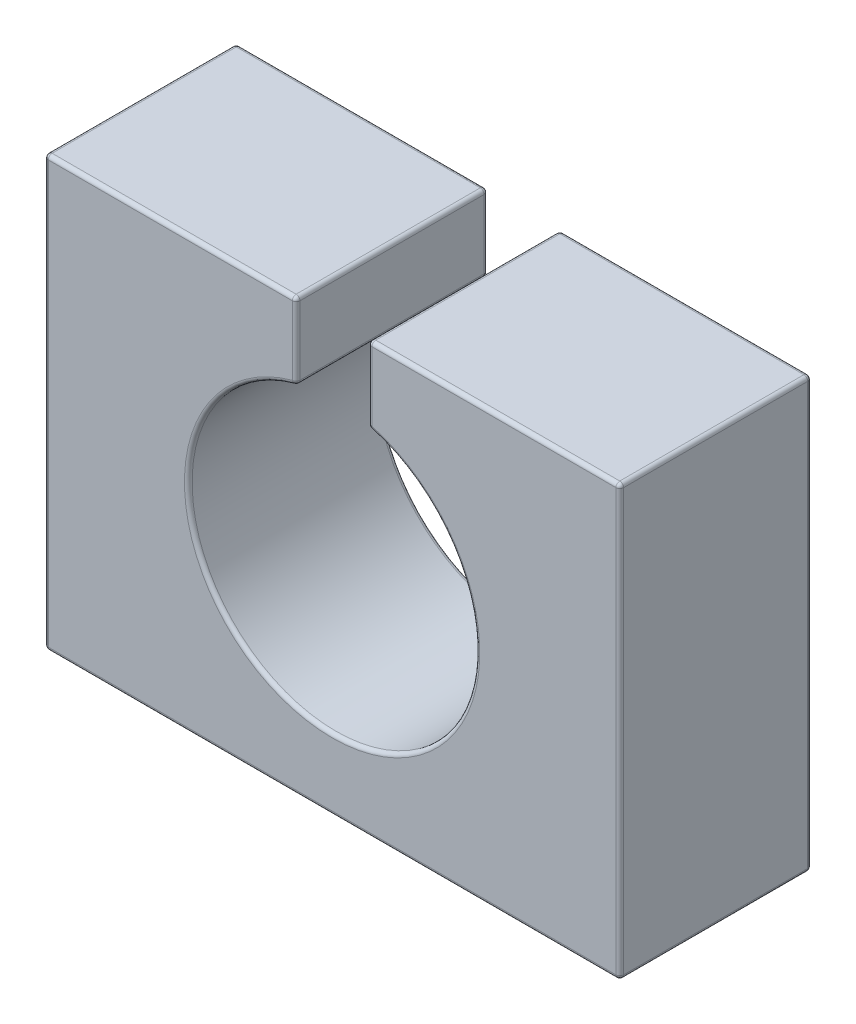
from build123d import *

# Parameters (mm, degrees)
SKETCH1_W           = 38.1
SKETCH1_H           = 28.448
BOSS_EXTRUDE1_DEPTH = 12.7
CUT_EXTRUDE2_REACH  = 51.216
FILLET1_R           = 0.254


with BuildPart() as part:
    # Sketch1 → Boss-Extrude1 (new body)
    with BuildSketch(Plane.XY):
        with Locations((19.05, 14.224)):
            Rectangle(SKETCH1_W, SKETCH1_H)
    extrude(amount=-BOSS_EXTRUDE1_DEPTH)

    # Sketch3 → Cut-Extrude2 (cut, up to next)
    with BuildSketch(Plane.XY, mode=Mode.PRIVATE) as cut_extrude2_sk1:
        with BuildLine():
            ThreePointArc((16.66875, 23.446541593), (19.05, 4.699), (21.43125, 23.446541593))
            Line((21.43125, 23.446541593), (21.43125, 28.448))
            Line((21.43125, 28.448), (16.66875, 28.448))
            Line((16.66875, 28.448), (16.66875, 23.446541593))
        make_face()
    cut_extrude2_tool1 = extrude(cut_extrude2_sk1.sketch, amount=-CUT_EXTRUDE2_REACH, mode=Mode.PRIVATE) & part.part
    add(cut_extrude2_tool1.solids().sort_by_distance((19.05, 15.101748, 0))[0], mode=Mode.SUBTRACT)

    # Fillet1
    fillet1_edges = [part.edges().sort_by_distance(p)[0] for p in [
        (21.43125, 25.947270797, -12.7),
        (21.43125, 28.448, -6.35),
        (29.765625, 28.448, -12.7),
        (38.1, 28.448, -6.35),
        (38.1, 14.224, -12.7),
        (21.43125, 25.947270797, 0),
        (29.765625, 28.448, 0),
        (38.1, 14.224, 0),
        (8.334375, 28.448, 0),
        (8.334375, 28.448, -12.7),
        (0, 14.224, -12.7),
        (0, 28.448, -6.35),
        (0, 14.224, 0),
        (38.1, 0, -6.35),
        (19.05, 0, -12.7),
        (0, 0, -6.35),
        (19.05, 0, 0),
        (21.43125, 23.446541593, -6.35),
        (19.05, 4.699, 0),
        (19.05, 4.699, -12.7),
        (16.66875, 23.446541593, -6.35),
        (16.66875, 25.947270797, 0),
        (16.66875, 28.448, -6.35),
        (16.66875, 25.947270797, -12.7),
    ]]
    fillet(fillet1_edges, radius=FILLET1_R)


solid = part.part
